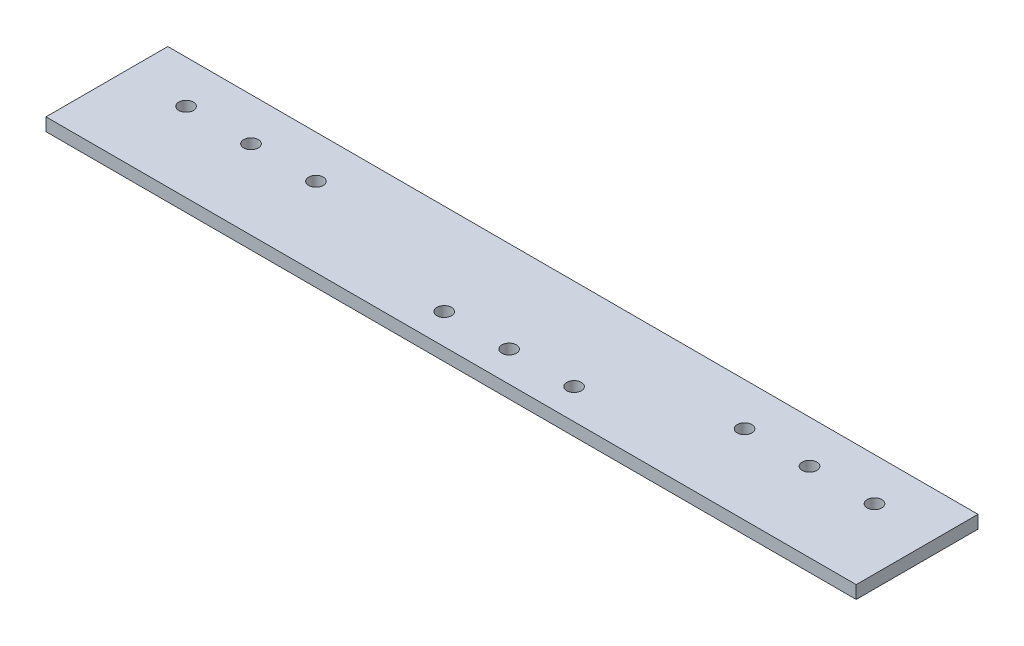
from build123d import *

# Parameters (mm, degrees)
SKETCH1_W           = 199.58
SKETCH1_H           = 30
BOSS_EXTRUDE1_DEPTH = 3.175
SKETCH2_R           = 1.8
CUT_EXTRUDE1_DEPTH  = 5


with BuildPart() as part:
    # Sketch1 → Boss-Extrude1 (new body)
    with BuildSketch(Plane(origin=(0, 0, 0), x_dir=(1, 0, 0), z_dir=(0, 1, 0))):
        with Locations((99.79, 15)):
            Rectangle(SKETCH1_W, SKETCH1_H)
    extrude(amount=BOSS_EXTRUDE1_DEPTH)

    # Sketch2 → Cut-Extrude1 (cut)
    with BuildSketch(Plane(origin=(0, 3.175, 0), x_dir=(1, 0, 0), z_dir=(0, 1, 0))):
        with Locations((47, 19.5)):
            Circle(SKETCH2_R)
        with Locations((31, 19.5)):
            Circle(SKETCH2_R)
        with Locations((15, 19.5)):
            Circle(SKETCH2_R)
        with Locations((90.58, 7.5)):
            Circle(SKETCH2_R)
        with Locations((106.58, 7.5)):
            Circle(SKETCH2_R)
        with Locations((168.58, 19.5)):
            Circle(SKETCH2_R)
        with Locations((184.58, 19.5)):
            Circle(SKETCH2_R)
        with Locations((152.58, 19.5)):
            Circle(SKETCH2_R)
        with Locations((122.58, 7.5)):
            Circle(SKETCH2_R)
    extrude(amount=-CUT_EXTRUDE1_DEPTH, mode=Mode.SUBTRACT)


solid = part.part
